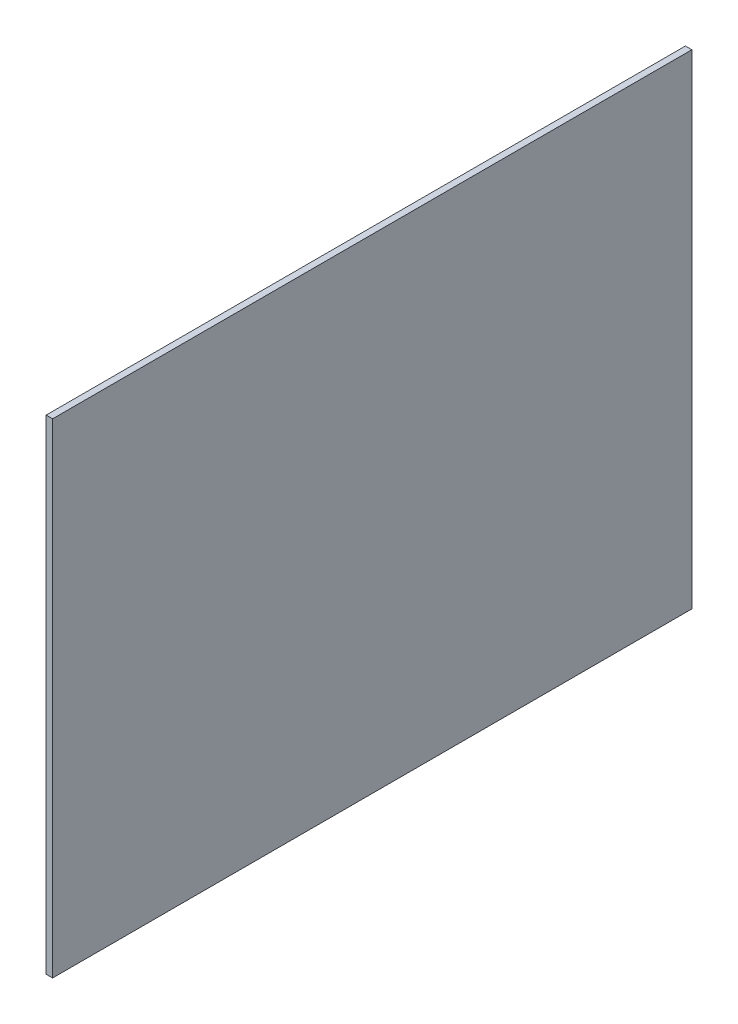
from build123d import *

# Parameters (mm, degrees)
SKETCH1_W          = 198
SKETCH1_H          = 150
BASE_FLANGE1_DEPTH = 2


# Sheet-metal steps are written as plain solids
with BuildPart() as part:
    # Sketch1 → Base-Flange1 (new body)
    with BuildSketch(Plane(origin=(0, 0, 0), x_dir=(0, 0, -1), z_dir=(1, 0, 0))):
        Rectangle(SKETCH1_W, SKETCH1_H)
    extrude(amount=-BASE_FLANGE1_DEPTH)


solid = part.part
